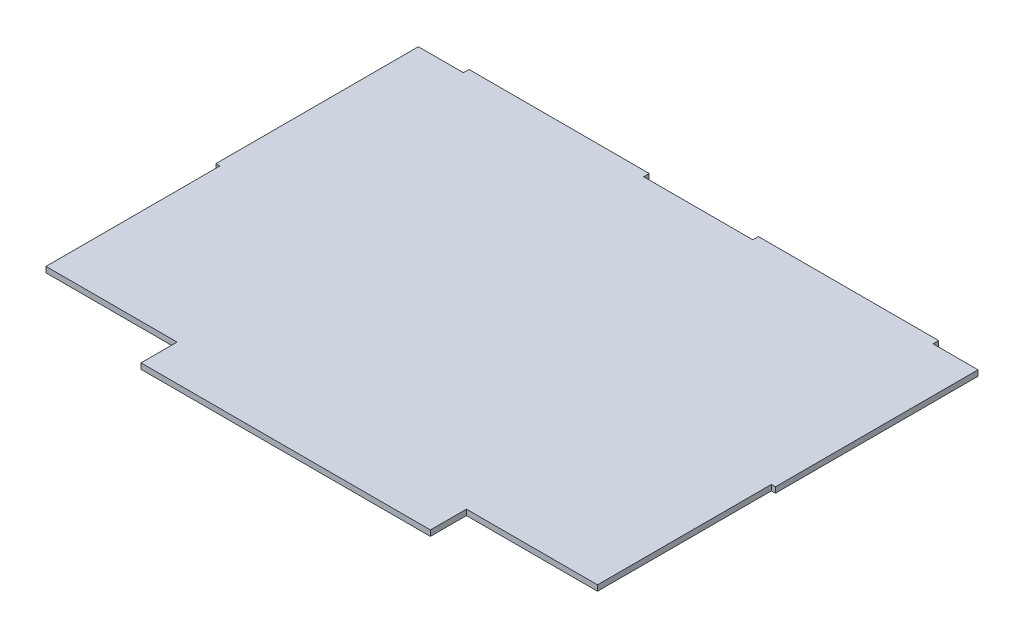
from build123d import *

# Parameters (mm, degrees)
SKETCH1_W           = 315.575
SKETCH1_H           = 3.175
BOSS_EXTRUDE1_DEPTH = 235.775
SKETCH3_W           = 25.4
SKETCH3_H           = 3.175
SKETCH3_W_2         = 61.575
CUT_EXTRUDE1_DEPTH  = 3.175
CUT_EXTRUDE2_START  = -3.175
SKETCH5_W           = 2.286
SKETCH5_H           = 118.364
CUT_EXTRUDE2_DEPTH  = 287.894626403
SKETCH6_W           = 73.909
SKETCH6_H           = 20.32
CUT_EXTRUDE4_DEPTH  = 284.719626403


with BuildPart() as part:
    # Sketch1 → Boss-Extrude1 (new body)
    with BuildSketch(Plane.XY):
        Rectangle(SKETCH1_W, SKETCH1_H)
    extrude(amount=BOSS_EXTRUDE1_DEPTH)

    # Sketch3 → Cut-Extrude1 (cut)
    with BuildSketch(Plane(origin=(0, 0, 0), x_dir=(-1, 0, 0), z_dir=(0, 0, -1))):
        with Locations((-145.0875, 0)):
            Rectangle(SKETCH3_W, SKETCH3_H)
        Rectangle(SKETCH3_W_2, SKETCH3_H)
        with Locations((145.0875, 0)):
            Rectangle(SKETCH3_W, SKETCH3_H)
    extrude(amount=-CUT_EXTRUDE1_DEPTH, mode=Mode.SUBTRACT)

    # Sketch5 → Cut-Extrude2 (cut)
    with BuildSketch(Plane(origin=(0, 1.5875, 0), x_dir=(1, 0, 0), z_dir=(0, 1, 0)).offset(CUT_EXTRUDE2_START)):
        with Locations((-156.6445, -176.593)):
            Rectangle(SKETCH5_W, SKETCH5_H)
    cut_extrude2 = extrude(amount=CUT_EXTRUDE2_DEPTH, mode=Mode.SUBTRACT)

    # Mirror1: Cut-Extrude2 across plane
    add(cut_extrude2.mirror(Plane(origin=(0, 0, 0), x_dir=(0, 0, 1), z_dir=(1, 0, 0))), mode=Mode.SUBTRACT)

    # Sketch6 → Cut-Extrude4 (cut, through all)
    with BuildSketch(Plane(origin=(0, 1.5875, 0), x_dir=(1, 0, 0), z_dir=(0, 1, 0))):
        with Locations((-118.547, -225.615)):
            Rectangle(SKETCH6_W, SKETCH6_H)
    cut_extrude4 = extrude(amount=-CUT_EXTRUDE4_DEPTH, mode=Mode.SUBTRACT)

    # Mirror2: Cut-Extrude4 across plane
    add(cut_extrude4.mirror(Plane(origin=(0, 0, 0), x_dir=(0, 0, 1), z_dir=(1, 0, 0))), mode=Mode.SUBTRACT)


solid = part.part
